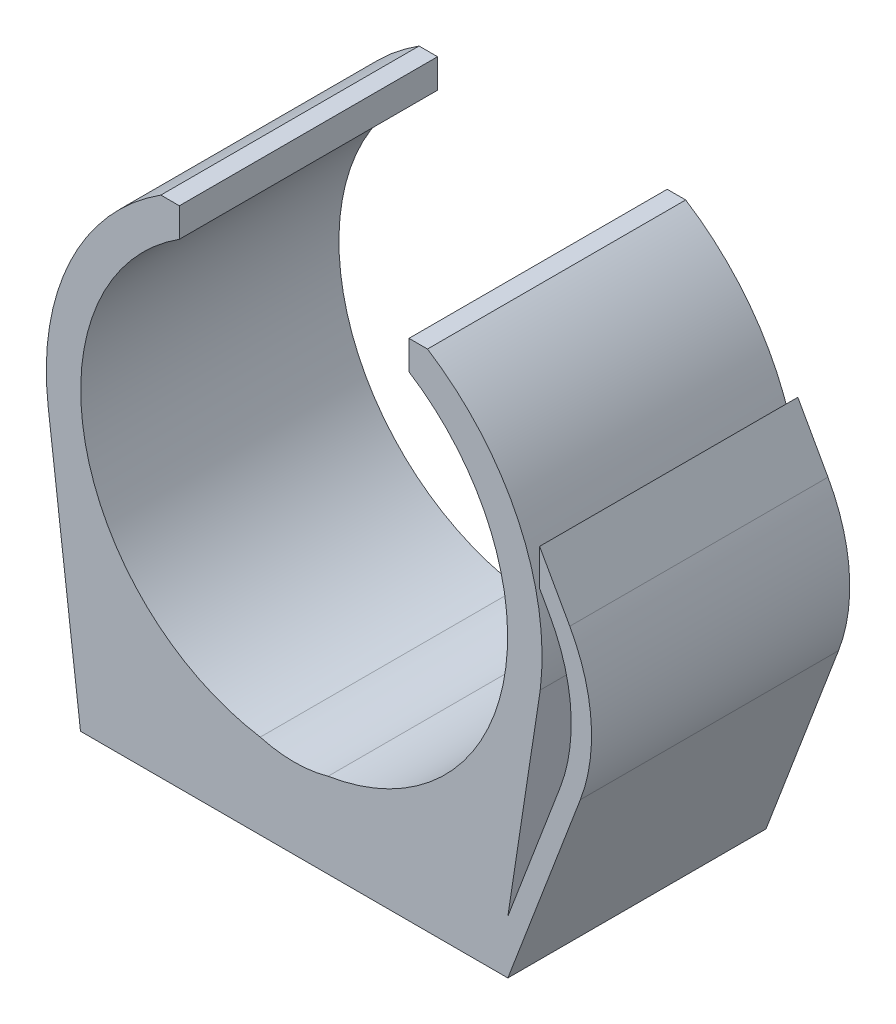
from build123d import *

# Parameters (mm, degrees)
BOSS_EXTRU_1_DEPTH = 15
CONG_3_R           = 10


with BuildPart() as part:
    # Esquisse1 → Boss.-Extru.1 (new body)
    with BuildSketch(Plane.XY):
        with BuildLine():
            Line((-12.413178268, -17.170718286), (12.413178268, -17.170718286))
            Line((12.413178268, -17.170718286), (18.278038706, -1.742740798))
            Line((18.278038706, -1.742740798), (14.259011067, 5.469333215))
            Line((14.259011067, 5.469333215), (14.259011067, 3.350972566))
            Line((14.259011067, 3.350972566), (17.09755304, -1.742740798))
            Line((17.09755304, -1.742740798), (12.413178268, -14.065357729))
            Line((12.413178268, -14.065357729), (14.294154557, -1.742740798))
            ThreePointArc((14.294154557, -1.742740798), (13.023591972, 6.143781583), (7.74523724, 12.139658154))
            Line((7.74523724, 12.139658154), (6.669509845, 12.139658154))
            Line((6.669509845, 12.139658154), (6.669509845, 10.453594522))
            ThreePointArc((6.669509845, 10.453594522), (12.142404364, -2.514361998), (1.969754735, -12.242551461))
            ThreePointArc((1.969754735, -12.242551461), (0, -12.515496015), (-1.969754735, -12.242551461))
            ThreePointArc((-1.969754735, -12.242551461), (-12.142404364, -2.514361998), (-6.669509845, 10.453594522))
            Line((-6.669509845, 10.453594522), (-6.669509845, 12.139658154))
            Line((-6.669509845, 12.139658154), (-7.74523724, 12.139658154))
            ThreePointArc((-7.74523724, 12.139658154), (-13.023591972, 6.143781583), (-14.294154557, -1.742740798))
            Line((-14.294154557, -1.742740798), (-12.413178268, -17.170718286))
        make_face()
    extrude(amount=BOSS_EXTRU_1_DEPTH)

    # Congé3
    cong_3_edges = [part.edges().sort_by_distance(p)[0] for p in [
        (17.09755304, -1.742740798, 7.5),
        (18.278038706, -1.742740798, 7.5),
    ]]
    fillet(cong_3_edges, radius=CONG_3_R)


solid = part.part
